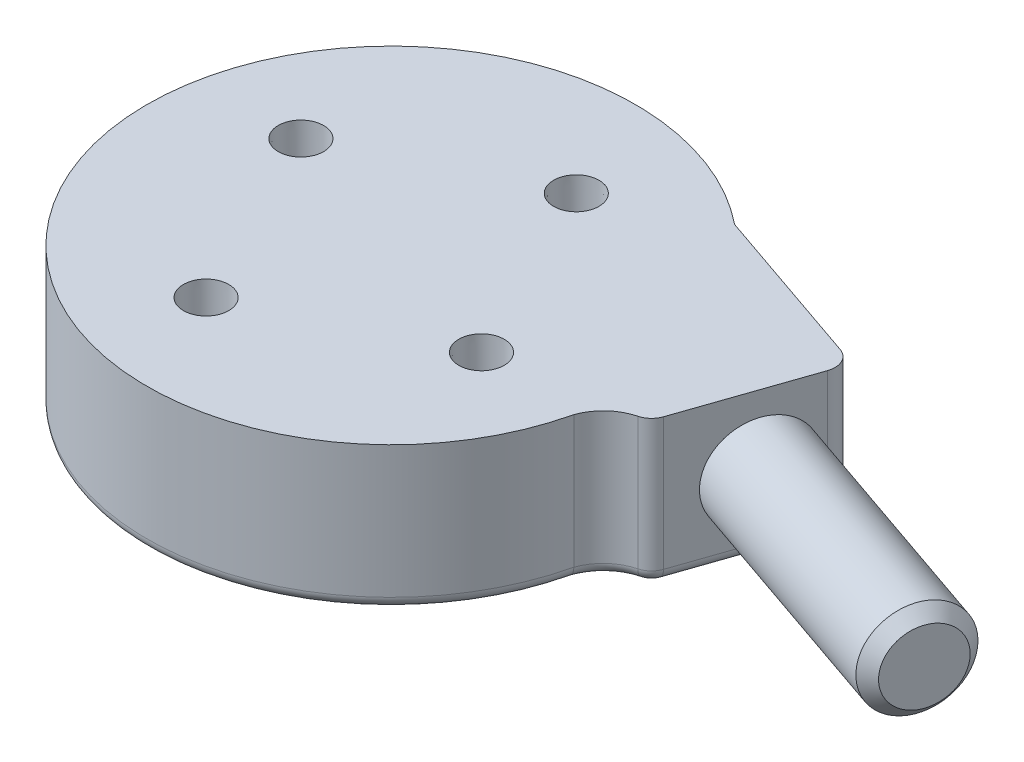
from build123d import *

# Parameters (mm, degrees)
STOCK_REFERENCE_START            = -175.975505736
STOCK_REFERENCE_SEAT_1_OUTLINE_R = 32.264078684
STOCK_REFERENCE_SEAT_1_DEPTH     = 15.311729992
STOCK_REFERENCE_SEAT_1_2_DEPTH   = 12.7
BOSS_EXTRUDE3_START              = 3.738270008
BOSS_EXTRUDE3_DEPTH              = 3.738270008
BOSS_EXTRUDE1_DEPTH              = 2.611729992
SKETCH2_R                        = 6.35
BOSS_EXTRUDE2_DEPTH              = 34.925
CHAMFER1_SIZE                    = 1.5875
FILLET1_R                        = 6.35
FILLET2_R                        = 2.54
FILLET3_R                        = 1.5875
HOLE1_AT_2_COUNT                 = 2
HOLE1_AT_2_PITCH                 = 27.213140303
HOLE1_AT_3_COUNT                 = 2
HOLE1_AT_3_PITCH                 = 38.485192091
HOLE1_AT_4_COUNT                 = 2
HOLE1_AT_4_PITCH                 = 27.213140303
F_8_CLEARANCE_HOLE1_D            = 4.9149
F_8_CLEARANCE_HOLE1_DEPTH        = 12.7
F_8_CLEARANCE_HOLE1_TIP          = 1.476584928


# Read off the part's stored shape, not the designer's step: Stock-Reference Seat-1
with BuildPart() as part:
    # Stock-Reference Seat-1 outline → Stock-Reference Seat-1 (new body)
    with BuildSketch(Plane(origin=(0, 0, 0), x_dir=(1, 0, 0), z_dir=(0, 1, 0)).offset(STOCK_REFERENCE_START)):
        with Locations((-264.046286299, 242.023928087)):
            Circle(STOCK_REFERENCE_SEAT_1_OUTLINE_R)
    extrude(amount=STOCK_REFERENCE_SEAT_1_DEPTH)

    # Stock-Reference Seat-1 2 outline → Stock-Reference Seat-1 2 (add)
    with BuildSketch(Plane(origin=(0, 0, 0), x_dir=(1, 0, 0), z_dir=(0, 1, 0)).offset(STOCK_REFERENCE_START)):
        with BuildLine():
            ThreePointArc((-243.756619182, 267.109784294), (-233.536149053, 252.516892329), (-232.618762484, 234.724508918))
            Line((-232.618762484, 234.724508918), (-230.711355396, 240.263016846))
            Line((-230.711355396, 240.263016846), (-226.943146121, 238.965283021))
            Line((-226.943146121, 238.965283021), (-220.060881103, 258.949207593))
            Line((-220.060881103, 258.949207593), (-243.756619182, 267.109784294))
        make_face()
    extrude(amount=STOCK_REFERENCE_SEAT_1_2_DEPTH)

    # Sketch7 → Boss-Extrude3 (add)
    with BuildSketch(Plane.XZ.offset(175.975505736).offset(BOSS_EXTRUDE3_START)):
        with BuildLine():
            Line((-243.756619182, -267.109784294), (-220.060881103, -258.949207593))
            Line((-220.060881103, -258.949207593), (-226.943146121, -238.965283021))
            Line((-226.943146121, -238.965283021), (-230.711355396, -240.263016846))
            Line((-230.711355396, -240.263016846), (-232.618762484, -234.724508918))
            ThreePointArc((-232.618762484, -234.724508918), (-294.556423545, -231.530963846), (-243.756619182, -267.109784294))
        make_face()
    extrude(amount=-BOSS_EXTRUDE3_DEPTH)

    # Sketch1 → Boss-Extrude1 (add)
    with BuildSketch(Plane(origin=(0, -163.275505736, 0), x_dir=(1, 0, 0), z_dir=(0, 1, 0))):
        with BuildLine():
            Line((-232.618762484, 234.724508918), (-230.711355396, 240.263016846))
            Line((-230.711355396, 240.263016846), (-226.943146121, 238.965283021))
            Line((-226.943146121, 238.965283021), (-220.060881103, 258.949207593))
            Line((-220.060881103, 258.949207593), (-243.756619182, 267.109784294))
            ThreePointArc((-243.756619182, 267.109784294), (-233.536149053, 252.516892329), (-232.618762484, 234.724508918))
        make_face()
    extrude(amount=BOSS_EXTRUDE1_DEPTH)

    # Sketch2 → Boss-Extrude2 (add)
    with BuildSketch(Plane(origin=(-276.451963722, 0, -95.207308867), x_dir=(0.325620940566074, 0, -0.9455003982362278), z_dir=(0.9455003982362278, 0, 0.32562094056607405))):
        with Locations((163.652309847, -170.188775744)):
            Circle(SKETCH2_R)
    extrude(amount=BOSS_EXTRUDE2_DEPTH)

    # Chamfer1
    chamfer1_edges = [part.edges().sort_by_distance(p)[0] for p in [
        (-192.209436228, -170.188775744, -232.564394121),
    ]]
    chamfer(chamfer1_edges, length=CHAMFER1_SIZE)

    # Fillet1
    # the kernel refuses this fillet: 6.35 mm, written as the material it adds along each edge
    with BuildSketch(Plane(origin=(-230.711355396, -175.975505736, -240.263016846), x_dir=(0.9455003982389363, 0, 0.3256209405582093), z_dir=(0, 1, 0))) as fillet1_piece_1:
        with BuildLine():
            CenterArc((6.349999999, -5.893320524), FILLET1_R, 111.862223466, 68.137776529)
            Line((-1e-09, -5.893320524), (-0.127000001, -5.893320524))
            Line((-0.127000001, -5.893320524), (-0.127, 0))
            Line((-0.127, 0), (0, 0.127))
            ThreePointArc((0, 0.127), (1.992706339, 0.127), (3.938120932, 0.11786641))
            Line((3.938120932, 0.11786641), (3.985412679, 0))
        make_face()
    extrude(amount=12.7)
    with BuildSketch(Plane(origin=(-230.711355396, -179.713775744, -240.263016846), x_dir=(0.9455003982362268, 0, 0.3256209405660767), z_dir=(0, 1, 0))) as fillet1_piece_2:
        with BuildLine():
            CenterArc((6.35, -5.893320524), FILLET1_R, 111.862223465, 68.137776535)
            Line((0, -5.893320524), (-0.127, -5.893320524))
            Line((-0.127, -5.893320524), (-0.127, 0))
            Line((-0.127, 0), (0, 0.127))
            ThreePointArc((0, 0.127), (1.99270634, 0.127), (3.938120933, 0.11786641))
            Line((3.938120933, 0.11786641), (3.98541268, 0))
        make_face()
    extrude(amount=3.738270008)
    with BuildSketch(Plane(origin=(-230.711355396, -163.275505736, -240.263016846), x_dir=(0.9455003982362268, 0, 0.3256209405660767), z_dir=(0, 1, 0))) as fillet1_piece_3:
        with BuildLine():
            CenterArc((6.35, -5.893320524), FILLET1_R, 111.862223465, 68.137776535)
            Line((0, -5.893320524), (-0.127, -5.893320524))
            Line((-0.127, -5.893320524), (-0.127, 0))
            Line((-0.127, 0), (0, 0.127))
            ThreePointArc((0, 0.127), (1.99270634, 0.127), (3.938120933, 0.11786641))
            Line((3.938120933, 0.11786641), (3.98541268, 0))
        make_face()
    extrude(amount=2.611729992)

    # Fillet2
    fillet2_edges = [part.edges().sort_by_distance(p)[0] for p in [
        (-226.943146121, -169.625505736, -238.965283021),
        (-220.060881103, -169.625505736, -258.949207593),
    ]]
    fillet(fillet2_edges, radius=FILLET2_R)

    # Fillet3
    fillet3_edges = [part.edges().sort_by_distance(p)[0] for p in [
        (-233.109535648, -179.713775744, -263.443034538),
        (-294.55657248, -179.713775744, -231.531396911),
        (-223.667862866, -179.713775744, -248.475671438),
        (-230.923127248, -179.713775744, -237.298737872),
        (-227.125556964, -179.713775744, -239.36526013),
        (-221.006530266, -179.713775744, -258.488049029),
    ]]
    fillet(fillet3_edges, radius=FILLET3_R)

    # Sketch4 → Hole1 (revolve, cut)
    with BuildSketch(Plane(origin=(-245.852404075, -160.663775744, -235.758135864), x_dir=(0, 0, 1), z_dir=(1, 0, 0))):
        Polygon((0, 0), (0, 4.699), (2.8702, 4.699), (2.9972, 0), align=None)
    hole1 = revolve(axis=Axis((-245.852404075, -270.663775744, -235.758135864), (0, 1, 0)), mode=Mode.SUBTRACT)

    # Hole1 at 2: Hole1 ×2
    with Locations(*[Vector(-0.8988185183780313, 0, 0.43832096803680365) * (i * HOLE1_AT_2_PITCH) for i in range(1, HOLE1_AT_2_COUNT)]):
        add(hole1, mode=Mode.SUBTRACT)

    # Hole1 at 3: Hole1 ×2
    with Locations(*[Vector(-0.945500398236235, 0, -0.3256209405660531) * (i * HOLE1_AT_3_PITCH) for i in range(1, HOLE1_AT_3_COUNT)]):
        add(hole1, mode=Mode.SUBTRACT)

    # Hole1 at 4: Hole1 ×2
    with Locations(*[Vector(-0.4383209680367791, 0, -0.8988185183780433) * (i * HOLE1_AT_4_PITCH) for i in range(1, HOLE1_AT_4_COUNT)]):
        add(hole1, mode=Mode.SUBTRACT)

    # #8 Clearance Hole1
    with Locations(Plane(origin=(0, -160.663775744, 0), x_dir=(1, 0, 0), z_dir=(0, 1, 0))):
        with Locations((-245.852404075, 235.758135864), (-270.312078522, 223.830045863), (-282.240168523, 248.289720311), (-257.780494076, 260.217810311)):
            Hole(F_8_CLEARANCE_HOLE1_D / 2, depth=F_8_CLEARANCE_HOLE1_DEPTH)
            with Locations((0, 0, -(F_8_CLEARANCE_HOLE1_DEPTH + F_8_CLEARANCE_HOLE1_TIP / 2))):  # 118° drill point
                Cone(0, F_8_CLEARANCE_HOLE1_D / 2, F_8_CLEARANCE_HOLE1_TIP, mode=Mode.SUBTRACT)


solid = part.part
